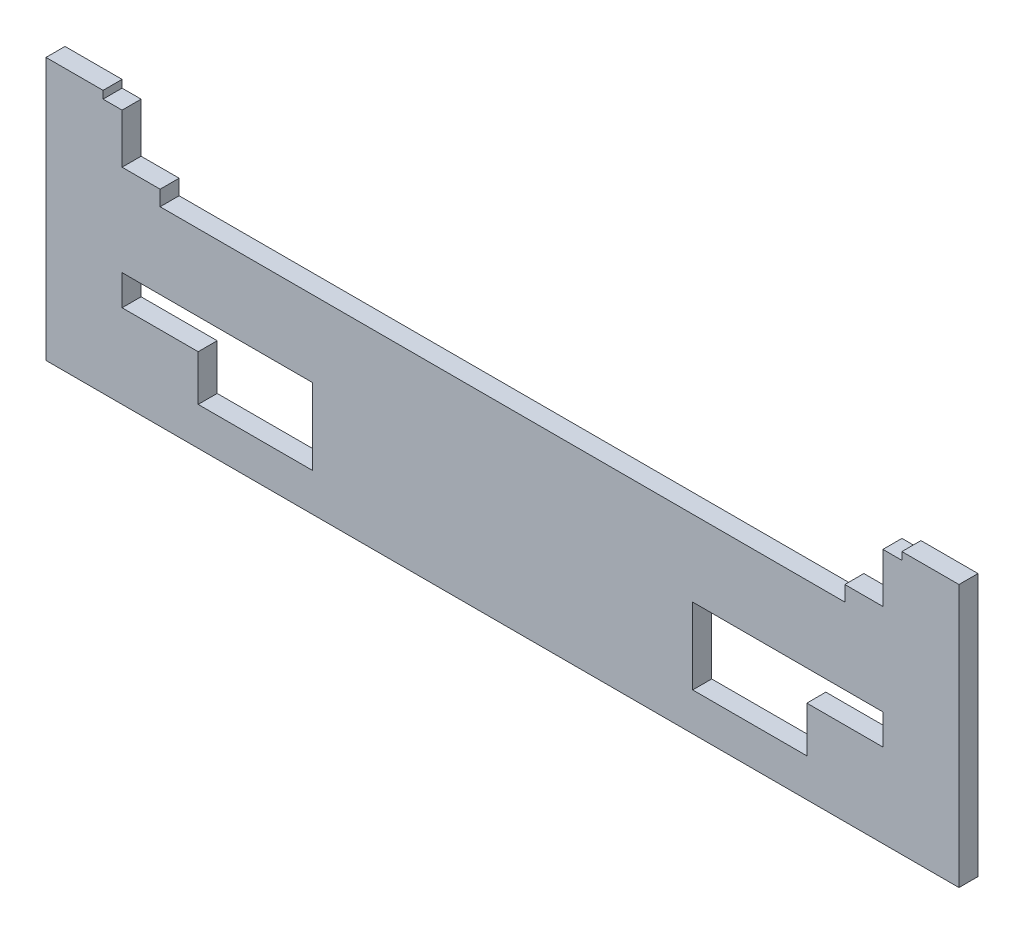
from build123d import *

# Parameters (mm, degrees)
BOSS_EXTRUDE1_DEPTH = 5
CUT_EXTRUDE5_REACH  = 251.772


with BuildPart() as part:
    # Sketch1 → Boss-Extrude1 (new body)
    with BuildSketch(Plane.XY):
        Polygon((0, 0), (240, 0), (240, 69), (225, 69), (225, 67), (220, 67), (220, 54), (210, 54), (210, 50), (30, 50), (30, 54), (20, 54), (20, 67), (15, 67), (15, 69), (0, 69), align=None)
    extrude(amount=BOSS_EXTRUDE1_DEPTH)

    # Sketch6 → Cut-Extrude5 (cut, up to next)
    with BuildSketch(Plane.XY.offset(5), mode=Mode.PRIVATE) as cut_extrude5_sk1:
        Polygon((20, 30), (70, 30), (70, 10), (40, 10), (40, 22), (20, 22), align=None)
    cut_extrude5_tool1 = extrude(cut_extrude5_sk1.sketch, amount=-CUT_EXTRUDE5_REACH, mode=Mode.PRIVATE) & part.part
    # Sketch6 → Cut-Extrude5 (cut, up to next)
    with BuildSketch(Plane.XY.offset(5), mode=Mode.PRIVATE) as cut_extrude5_sk2:
        Polygon((220, 22), (220, 30), (170, 30), (170, 10), (200, 10), (200, 22), align=None)
    cut_extrude5_tool2 = extrude(cut_extrude5_sk2.sketch, amount=-CUT_EXTRUDE5_REACH, mode=Mode.PRIVATE) & part.part
    add(cut_extrude5_tool1.solids().sort_by_distance((49.736842, 21.263158, 5))[0], mode=Mode.SUBTRACT)
    add(cut_extrude5_tool2.solids().sort_by_distance((190.263158, 21.263158, 5))[0], mode=Mode.SUBTRACT)


solid = part.part
